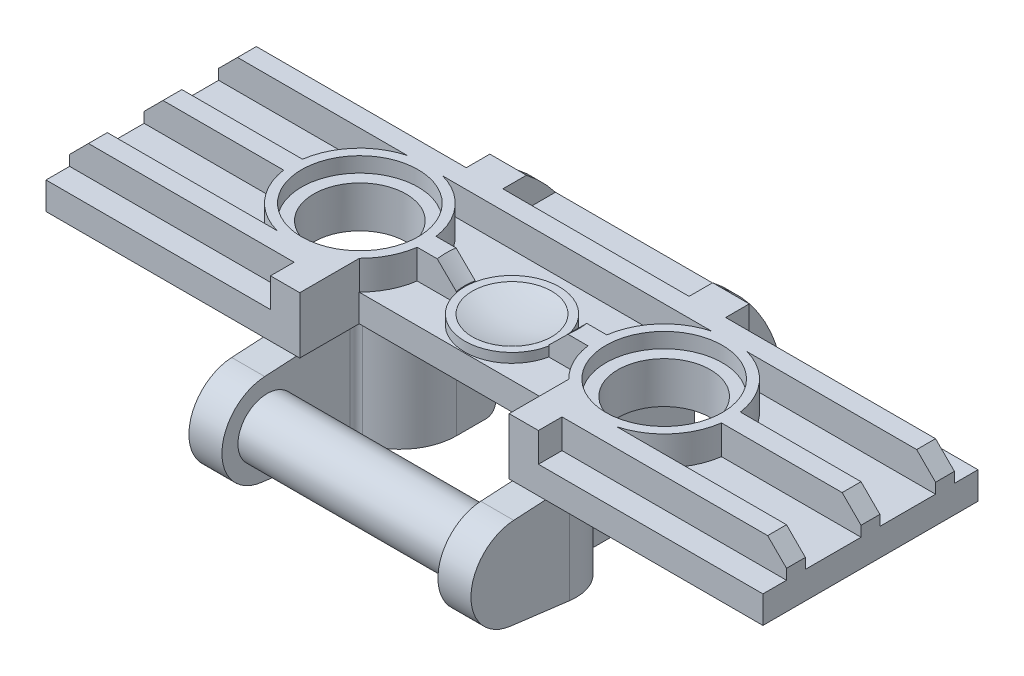
from build123d import *

# Parameters (mm, degrees)
SKETCH2_W            = 38
SKETCH2_H            = 11.4
BOSS_EXTRUDE1_DEPTH  = 1.45
SKETCH1_R            = 3.0875
BOSS_EXTRUDE2_DEPTH  = 1.55
SKETCH4_W            = 11.1
SKETCH4_H            = 3.15
CUT_EXTRUDE1_DEPTH   = 1.55
SKETCH5_R            = 2.5
BOSS_EXTRUDE3_DEPTH  = 0.5
SKETCH6_W            = 2.1
SKETCH6_H            = 6.8
BOSS_EXTRUDE4_DEPTH  = 5.5
BOSS_EXTRUDE5_DEPTH  = 2.1
SKETCH10_W           = 1.8
SKETCH10_H           = 1.137503558
CUT_EXTRUDE2_DEPTH   = 13.5
BOSS_EXTRUDE6_START  = -3.325
BOSS_EXTRUDE6_DEPTH  = 6.65
SKETCH13_W           = 1.609894421
SKETCH13_H           = 2.787309827
SKETCH13_H_2         = 3.919277545
CUT_EXTRUDE3_DEPTH   = 4.25
SKETCH14_R           = 2.399672092
SKETCH14_R_2         = 1.55
BOSS_EXTRUDE9_DEPTH  = 1.75
SKETCH15_R           = 1.55
BOSS_EXTRUDE10_DEPTH = 13.2
SKETCH19_W           = 4.15
SKETCH19_H           = 0.9812524
BOSS_EXTRUDE11_DEPTH = 5.5
FILLET1_R            = 3
FILLET2_R            = 0.5
CHAMFER1_SIZE        = 1
SKETCH20_R           = 2.45
CUT_EXTRUDE4_DEPTH   = 3.125
SKETCH21_R           = 3.0875
CUT_EXTRUDE5_DEPTH   = 0.8
FILLET5_R            = 0.4


# Read off the part's stored shape, not the designer's step: Boss-Extrude6
with BuildPart() as part:
    # Sketch2 → Boss-Extrude1 (new body)
    with BuildSketch(Plane(origin=(0, 0, 0), x_dir=(1, 0, 0), z_dir=(0, 1, 0))):
        Rectangle(SKETCH2_W, SKETCH2_H)
    extrude(amount=-BOSS_EXTRUDE1_DEPTH)

    # Sketch1 → Boss-Extrude2 (add)
    # profile 1 of 3: a face of its own
    with BuildSketch(Plane(origin=(0, 0, 0), x_dir=(1, 0, 0), z_dir=(0, 1, 0))):
        with BuildLine():
            ThreePointArc((-2.449489743, 0.5), (-2.5, 0), (-2.449489743, -0.5))
            Line((-2.449489743, -0.5), (-4.525137715, -0.5))
            ThreePointArc((-4.525137715, -0.5), (-4.870238296, -1.60440726), (-5.55, -2.540747921))
            Line((-5.55, -2.540747921), (-5.55, -5.7))
            Line((-5.55, -5.7), (-7.1, -5.7))
            Line((-7.1, -5.7), (-7.1, -4.45))
            Line((-7.1, -4.45), (-19, -4.45))
            Line((-19, -4.45), (-19, -3.45))
            Line((-19, -3.45), (-9.002083241, -3.45))
            ThreePointArc((-9.002083241, -3.45), (-10.745743425, -2.365214512), (-11.604862285, -0.5))
            Line((-11.604862285, -0.5), (-19, -0.5))
            Line((-19, -0.5), (-19, 0.5))
            Line((-19, 0.5), (-11.604862285, 0.5))
            ThreePointArc((-11.604862285, 0.5), (-10.745743425, 2.365214512), (-9.002083241, 3.45))
            Line((-9.002083241, 3.45), (-19, 3.45))
            Line((-19, 3.45), (-19, 4.45))
            Line((-19, 4.45), (-6.875, 4.45))
            Line((-6.875, 4.45), (-6.875, 5.7))
            Line((-6.875, 5.7), (-4.975, 5.7))
            Line((-4.975, 5.7), (-4.975, 4.45))
            Line((-4.975, 4.45), (4.975, 4.45))
            Line((4.975, 4.45), (4.975, 5.7))
            Line((4.975, 5.7), (6.875, 5.7))
            Line((6.875, 5.7), (6.875, 4.45))
            Line((6.875, 4.45), (19, 4.45))
            Line((19, 4.45), (19, 3.45))
            Line((19, 3.45), (9.002083241, 3.45))
            ThreePointArc((9.002083241, 3.45), (10.745743425, 2.365214512), (11.604862285, 0.5))
            Line((11.604862285, 0.5), (19, 0.5))
            Line((19, 0.5), (19, -0.5))
            Line((19, -0.5), (11.604862285, -0.5))
            ThreePointArc((11.604862285, -0.5), (10.745743425, -2.365214512), (9.002083241, -3.45))
            Line((9.002083241, -3.45), (19, -3.45))
            Line((19, -3.45), (19, -4.45))
            Line((19, -4.45), (7.1, -4.45))
            Line((7.1, -4.45), (7.1, -5.7))
            Line((7.1, -5.7), (5.55, -5.7))
            Line((5.55, -5.7), (5.55, -2.540747921))
            ThreePointArc((5.55, -2.540747921), (4.870238296, -1.60440726), (4.525137715, -0.5))
            Line((4.525137715, -0.5), (2.449489743, -0.5))
            ThreePointArc((2.449489743, -0.5), (2.5, 0), (2.449489743, 0.5))
            Line((2.449489743, 0.5), (4.525137715, 0.5))
            ThreePointArc((4.525137715, 0.5), (5.384256575, 2.365214512), (7.127916759, 3.45))
            Line((7.127916759, 3.45), (-7.127916759, 3.45))
            ThreePointArc((-7.127916759, 3.45), (-5.384256575, 2.365214512), (-4.525137715, 0.5))
            Line((-4.525137715, 0.5), (-2.449489743, 0.5))
        make_face()
        with Locations((8.065, 0)):
            Circle(SKETCH1_R, mode=Mode.SUBTRACT)
        with Locations((-8.065, 0)):
            Circle(SKETCH1_R, mode=Mode.SUBTRACT)
    # profile 2 of 3: a face of its own
    with BuildSketch(Plane(origin=(0, 0, 0), x_dir=(1, 0, 0), z_dir=(0, 1, 0))):
        with Locations((-8.065, 0)):
            Circle(SKETCH1_R)
    # profile 3 of 3: a face of its own
    with BuildSketch(Plane(origin=(0, 0, 0), x_dir=(1, 0, 0), z_dir=(0, 1, 0))):
        with Locations((8.065, 0)):
            Circle(SKETCH1_R)
    extrude(amount=BOSS_EXTRUDE2_DEPTH)

    # Sketch4 → Cut-Extrude1 (cut)
    with BuildSketch(Plane(origin=(0, 0, 0), x_dir=(1, 0, 0), z_dir=(0, 1, 0))):
        with Locations((0, -4.125)):
            Rectangle(SKETCH4_W, SKETCH4_H)
    extrude(amount=-CUT_EXTRUDE1_DEPTH, mode=Mode.SUBTRACT)

    # Sketch5 → Boss-Extrude3 (add)
    with BuildSketch(Plane(origin=(0, 0, 0), x_dir=(1, 0, 0), z_dir=(0, 1, 0))):
        Circle(SKETCH5_R)
    extrude(amount=BOSS_EXTRUDE3_DEPTH)

    # Sketch6 → Boss-Extrude4 (add)
    with BuildSketch(Plane.XZ.offset(1.45)):
        with Locations((-4.375, -0.85)):
            Rectangle(SKETCH6_W, SKETCH6_H)
        with Locations((4.375, -0.85)):
            Rectangle(SKETCH6_W, SKETCH6_H)
    extrude(amount=BOSS_EXTRUDE4_DEPTH)

    # Sketch8 → Boss-Extrude5 (add)
    with BuildSketch(Plane(origin=(5.425, 0, 0), x_dir=(0, 0, -1), z_dir=(1, 0, 0))):
        with BuildLine():
            Line((3.824457799, 1.55), (3.169391593, -1.45))
            Line((3.169391593, -1.45), (4.25, -1.45))
            Line((4.25, -1.45), (4.25, -3.2))
            ThreePointArc((4.25, -3.2), (6.591222467, -2.434687171), (6.999675652, -4.863718328))
            ThreePointArc((6.999675652, -4.863718328), (6.917672859, -5.503870326), (7.462386809, -5.85))
            Line((7.462386809, -5.85), (8.635307609, -5.85))
            Line((8.635307609, -5.85), (8.99741287, -4.588093961))
            ThreePointArc((8.99741287, -4.588093961), (7.994798141, -1.171963485), (5.7, 1.55))
            Line((5.7, 1.55), (3.824457799, 1.55))
        make_face()
        with BuildLine():
            Line((4.25, -4.45), (4.25, -5.812496442))
            ThreePointArc((4.25, -5.812496442), (4.621012042, -5.404327986), (4.501999453, -4.865730337))
            ThreePointArc((4.501999453, -4.865730337), (4.360365271, -4.667342163), (4.25, -4.45))
        make_face()
    boss_extrude5 = extrude(amount=-BOSS_EXTRUDE5_DEPTH)

    # Sketch10 → Cut-Extrude2 (cut)
    with BuildSketch(Plane(origin=(5.425, 0, 0), x_dir=(0, 0, -1), z_dir=(1, 0, 0))):
        with Locations((3.35, -6.381248221)):
            Rectangle(SKETCH10_W, SKETCH10_H)
    extrude(amount=-CUT_EXTRUDE2_DEPTH, mode=Mode.SUBTRACT)

    # Mirror2: Boss-Extrude5 across plane
    add(boss_extrude5.mirror(Plane(origin=(0, 0, 0), x_dir=(0, 0, 1), z_dir=(1, 0, 0))))

    # Boss-Extrude6 outline → Boss-Extrude6 (add)
    with BuildSketch(Plane.YZ.offset(BOSS_EXTRUDE6_START)):
        with BuildLine():
            Line((0, -5.7), (-1.45, -5.7))
            Line((-1.45, -5.7), (-1.45, -8.137740985))
            ThreePointArc((-1.45, -8.137740985), (-0.702713526, -7.723414198), (0, -7.237309827))
            Line((0, -7.237309827), (0, -5.7))
        make_face()
    extrude(amount=BOSS_EXTRUDE6_DEPTH)

    # Sketch13 → Cut-Extrude3 (cut)
    with BuildSketch(Plane(origin=(0, 0, 0), x_dir=(1, 0, 0), z_dir=(0, 1, 0))):
        with Locations((-4.129947211, 5.843654913)):
            Rectangle(SKETCH13_W, SKETCH13_H)
        with Locations((4.129947211, 6.409638773)):
            Rectangle(SKETCH13_W, SKETCH13_H_2)
    extrude(amount=CUT_EXTRUDE3_DEPTH, mode=Mode.SUBTRACT)

    # Sketch14 → Boss-Extrude9 (add)
    # profile 1 of 3: a face of its own
    with BuildSketch(Plane(origin=(7.475, 0, 0), x_dir=(0, 0, -1), z_dir=(1, 0, 0))):
        with BuildLine():
            Line((-7.549815065, -6.320389595), (-2.55, -6.95))
            Line((-2.55, -6.95), (-1.989793561, -6.95))
            Line((-1.989793561, -6.95), (-1.989793561, -1.45))
            Line((-1.989793561, -1.45), (-2.55, -1.45))
            Line((-2.55, -1.45), (-5.7, -1.45))
            Line((-5.7, -1.45), (-7.383162468, -1.543546098))
            ThreePointArc((-7.383162468, -1.543546098), (-5.60092755, -2.196251792), (-4.850327908, -3.93952062))
            ThreePointArc((-4.850327908, -3.93952062), (-5.662711698, -5.739226706), (-7.549815065, -6.320389595))
        make_face()
    # profile 2 of 3: a face of its own
    with BuildSketch(Plane(origin=(7.475, 0, 0), x_dir=(0, 0, -1), z_dir=(1, 0, 0))):
        with Locations((-7.25, -3.93952062)):
            Circle(SKETCH14_R)
        with Locations((-7.25, -3.93952062)):
            Circle(SKETCH14_R_2, mode=Mode.SUBTRACT)
    # profile 3 of 3: a face of its own
    with BuildSketch(Plane(origin=(7.475, 0, 0), x_dir=(0, 0, -1), z_dir=(1, 0, 0))):
        with Locations((-7.25, -3.93952062)):
            Circle(SKETCH14_R_2)
    boss_extrude9 = extrude(amount=-BOSS_EXTRUDE9_DEPTH)

    # Mirror3: Boss-Extrude9 across plane
    add(boss_extrude9.mirror(Plane(origin=(0, 0, 0), x_dir=(0, 0, 1), z_dir=(1, 0, 0))))

    # Sketch15 → Boss-Extrude10 (add)
    with BuildSketch(Plane.ZY.offset(7.475)):
        with Locations((7.25, -3.93952062)):
            Circle(SKETCH15_R)
    extrude(amount=-BOSS_EXTRUDE10_DEPTH)

    # Sketch17 → Cut-Revolve4 (revolve, cut)
    with BuildSketch(Plane.XY):
        with BuildLine():
            Line((2.1, 0.5), (2.1, 0.710906592))
            Line((2.1, 0.710906592), (0, 1.053607594))
            Line((0, 1.053607594), (0, 0.183808769))
            ThreePointArc((0, 0.183808769), (1.061835309, 0.263299583), (2.1, 0.5))
        make_face()
    revolve(axis=Axis((0, 1.053607594, 0), (0, -1, 0)), mode=Mode.SUBTRACT)

    # Sketch19 → Boss-Extrude11 (add)
    with BuildSketch(Plane.XZ.offset(6.95)):
        with Locations((5.4, 2.0593738)):
            Rectangle(SKETCH19_W, SKETCH19_H)
    boss_extrude11 = extrude(amount=-BOSS_EXTRUDE11_DEPTH)

    # Mirror4: Boss-Extrude11 across plane
    add(boss_extrude11.mirror(Plane(origin=(0, 0, 0), x_dir=(0, 0, 1), z_dir=(1, 0, 0))))

    # Fillet1
    # the kernel refuses this fillet: 3 mm, written as the material it takes off along each edge
    with BuildSketch(Plane(origin=(7.475, -14.064026638, 1.5687476), x_dir=(-1, 0, 0), z_dir=(0, 1, 0))) as fillet1_piece_1:
        with BuildLine():
            CenterArc((3, 2.845610655), FILLET1_R, 180, 71.538541703)
            Line((0, 2.845610655), (0, 0))
            Line((0, 0), (2.05, 0))
        make_face()
    extrude(amount=12.614026638, mode=Mode.SUBTRACT)
    with BuildSketch(Plane(origin=(3.325, -1.45, 2.55), x_dir=(0, 0, -1), z_dir=(0, -1, 0))) as fillet1_piece_2:
        with BuildLine():
            CenterArc((2.939387691, 3), FILLET1_R, 191.536959033, 78.463040967)
            Line((0, 2.4), (0, 0))
            Line((0, 0), (2.939387691, 0))
        make_face()
    extrude(amount=12.848469228, mode=Mode.SUBTRACT)
    with BuildSketch(Plane(origin=(-3.325, -1.45, 2.55), x_dir=(0, 0, -1), z_dir=(0, -1, 0))) as fillet1_piece_3:
        with BuildLine():
            CenterArc((2.939387691, -3), FILLET1_R, 90, 78.463040967)
            Line((0, -2.4), (0, 0))
            Line((0, 0), (2.939387691, 0))
        make_face()
    extrude(amount=12.848469228, mode=Mode.SUBTRACT)
    with BuildSketch(Plane(origin=(-7.475, -14.064026638, 1.5687476), x_dir=(0, 0, 1), z_dir=(0, 1, 0))) as fillet1_piece_4:
        with BuildLine():
            CenterArc((2.845610655, 3), FILLET1_R, 198.461458297, 71.538541703)
            Line((0, 2.05), (0, 0))
            Line((0, 0), (2.845610655, 0))
        make_face()
    extrude(amount=12.614026638, mode=Mode.SUBTRACT)

    # Fillet2
    fillet2_edges = [part.edges().sort_by_distance(p)[0] for p in [
        (4.375, -4.588093961, -8.99741287),
        (4.375, -5.85, -8.635307609),
        (4.375, -6.95, -2.45),
        (-4.375, -6.95, -2.45),
        (-4.375, -5.85, -8.635307609),
        (-4.375, -4.588093961, -8.99741287),
    ]]
    fillet(fillet2_edges, radius=FILLET2_R)

    # Chamfer1
    chamfer1_edges = [part.edges().sort_by_distance(p)[0] for p in [
        (-2.5, 1.55, 0),
        (2.5, 1.55, 0),
        (-19, 1.55, -3.95),
        (-19, 1.55, 0),
        (-19, 1.55, 3.95),
        (19, 1.55, 3.95),
        (19, 1.55, 0),
        (19, 1.55, -3.95),
    ]]
    chamfer(chamfer1_edges, length=CHAMFER1_SIZE)

    # Sketch20 → Cut-Extrude4 (cut, symmetric)
    with BuildSketch(Plane(origin=(0, 0, 0), x_dir=(1, 0, 0), z_dir=(0, 1, 0))):
        with Locations(Location((-8.065, 0, 0), (0, 0, 270))):
            Circle(SKETCH20_R)
        with Locations(Location((8.065, 0, 0), (0, 0, 270))):
            Circle(SKETCH20_R)
    extrude(amount=CUT_EXTRUDE4_DEPTH, both=True, mode=Mode.SUBTRACT)

    # Sketch21 → Cut-Extrude5 (cut)
    with BuildSketch(Plane(origin=(0, 1.55, 0), x_dir=(1, 0, 0), z_dir=(0, 1, 0))):
        with Locations(Location((-8.065, 0, 0), (0, 0, 270))):
            Circle(SKETCH21_R)
        with Locations(Location((8.065, 0, 0), (0, 0, 270))):
            Circle(SKETCH21_R)
    extrude(amount=-CUT_EXTRUDE5_DEPTH, mode=Mode.SUBTRACT)

    # Fillet5
    fillet5_edges = [part.edges().sort_by_distance(p)[0] for p in [
        (5.425, -4.2, 1.5687476),
        (-5.425, -4.2, 1.5687476),
        (-5.725, -4.2, 2.55),
        (5.725, -4.2, 2.55),
    ]]
    fillet(fillet5_edges, radius=FILLET5_R)


solid = part.part
